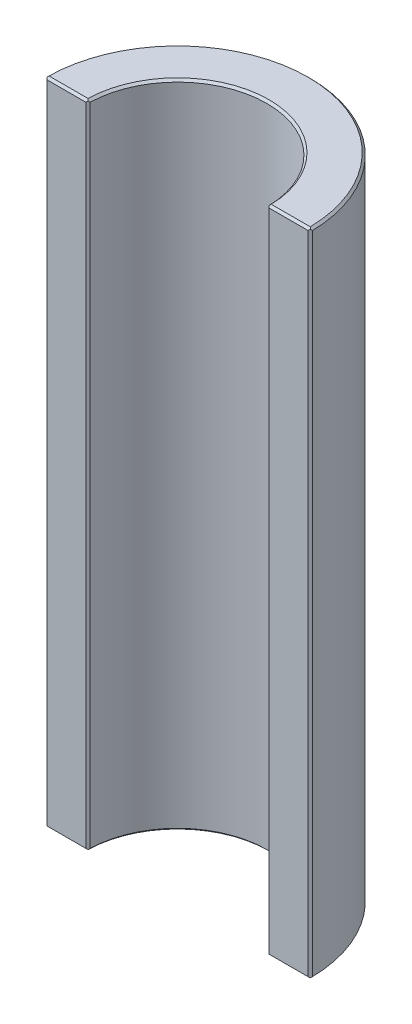
from build123d import *

# Parameters (mm, degrees)
EXTRUDE_1_DEPTH = 120
CHAMFER_2_SIZE  = 0.4


with BuildPart() as part:
    # 草图1 → 凸台-拉伸1 (new body)
    with BuildSketch(Plane(origin=(0, 0, 0), x_dir=(1, 0, 0), z_dir=(0, 1, 0))):
        with BuildLine():
            Line((-24.5, 0), (-16.5, 0))
            ThreePointArc((-16.5, 0), (0, 16.5), (16.5, 0))
            Line((16.5, 0), (24.5, 0))
            ThreePointArc((24.5, 0), (0, 24.5), (-24.5, 0))
        make_face()
    extrude(amount=EXTRUDE_1_DEPTH)

    # 倒角1
    # the kernel refuses this chamfer: 0.4 mm, written as the material it takes off along each edge
    with BuildSketch(Plane(origin=(15.471326805, 120, 0), x_dir=(0, -0.9996219169112966, 0.027495876610585543), z_dir=(1, 0, 0)), Plane(origin=(-25.528673195, 120, 0), x_dir=(0, -0.9996219169112966, 0.027495876610585543), z_dir=(1, 0, 0))) as chamfer_1_piece_1:
        with BuildLine():
            Line((0.411469278, 0), (-0.022618862, 0.410847117))
            Line((-0.022618862, 0.410847117), (-0.030615837, 0.41062715))
            ThreePointArc((-0.030615837, 0.41062715), (-0.013651691, 0.205359132), (-0.007996975, -0.000219967))
            Line((-0.007996975, -0.000219967), (0.000219967, -0.007996975))
            ThreePointArc((0.000219967, -0.007996975), (0.205799066, -0.00234226), (0.411689245, -0.007996975))
            Line((0.411689245, -0.007996975), (0.411469278, 0))
        make_face()
    extrude(amount=10.05734639, mode=Mode.SUBTRACT)
    with BuildSketch(Plane(origin=(15.471326805, 0, 0), x_dir=(0, 0.9996219169112968, 0.02749587661058639), z_dir=(1, 0, 0)), Plane(origin=(-25.528673195, 0, 0), x_dir=(0, 0.9996219169112968, 0.02749587661058639), z_dir=(1, 0, 0))) as chamfer_1_piece_2:
        with BuildLine():
            Line((0.411469278, 0), (-0.022618862, -0.410847117))
            Line((-0.022618862, -0.410847117), (-0.030615837, -0.41062715))
            ThreePointArc((-0.030615837, -0.41062715), (-0.013651691, -0.205359132), (-0.007996975, 0.000219967))
            Line((-0.007996975, 0.000219967), (0.000219967, 0.007996975))
            ThreePointArc((0.000219967, 0.007996975), (0.205799066, 0.00234226), (0.411689245, 0.007996975))
            Line((0.411689245, 0.007996975), (0.411469278, 0))
        make_face()
    extrude(amount=10.05734639, mode=Mode.SUBTRACT)
    with BuildSketch(Plane(origin=(24.5, -1.045299528, 0), x_dir=(-0.9996215998180249, 0, 0.0275074022265361), z_dir=(0, 1, 0))) as chamfer_1_piece_3:
        with BuildLine():
            Line((0.414696078, 0), (-0.019340993, -0.417672243))
            Line((-0.019340993, -0.417672243), (-0.027340517, -0.417584944))
            ThreePointArc((-0.027340517, -0.417584944), (-0.012856137, -0.208775648), (-0.007996973, 0.000220059))
            Line((-0.007996973, 0.000220059), (0.000220059, 0.007996973))
            ThreePointArc((0.000220059, 0.007996973), (0.207411207, 0.002295525), (0.414916137, 0.007996973))
            Line((0.414916137, 0.007996973), (0.414696078, 0))
        make_face()
    extrude(amount=122.090599055, mode=Mode.SUBTRACT)
    with BuildSketch(Plane(origin=(16.5, -1.017165076, 0), x_dir=(-0.039969745571149635, 0, -0.9992008904314376), z_dir=(0, 1, 0))) as chamfer_1_piece_4:
        with BuildLine():
            Line((0.402032829, 0), (-0.027426276, -0.405940594))
            Line((-0.027426276, -0.405940594), (-0.035419883, -0.405620836))
            ThreePointArc((-0.035419883, -0.405620836), (-0.016121703, -0.20287395), (-0.007993607, 0.000319758))
            Line((-0.007993607, 0.000319758), (0.000319758, 0.007993607))
            ThreePointArc((0.000319758, 0.007993607), (0.201049453, 0.001188032), (0.4021633, 0.007998936))
            Line((0.4021633, 0.007998936), (0.402032829, 0))
        make_face()
    extrude(amount=122.034330152, mode=Mode.SUBTRACT)
    with BuildSketch(Plane(origin=(-16.5, -1.017165076, 0), x_dir=(-0.9996224657663016, 0, 0.02747591554978717), z_dir=(0, 1, 0))) as chamfer_1_piece_5:
        with BuildLine():
            Line((0.40686603, 0), (-0.027100476, -0.401118387))
            Line((-0.027100476, -0.401118387), (-0.035090013, -0.400709363))
            ThreePointArc((-0.035090013, -0.400709363), (-0.014737795, -0.200512073), (-0.00799698, 0.000219807))
            Line((-0.00799698, 0.000219807), (0.000219807, 0.00799698))
            ThreePointArc((0.000219807, 0.00799698), (0.203499246, 0.002409582), (0.407085838, 0.00799698))
            Line((0.407085838, 0.00799698), (0.40686603, 0))
        make_face()
    extrude(amount=122.034330152, mode=Mode.SUBTRACT)
    with BuildSketch(Plane(origin=(-24.5, -1.045299528, 0), x_dir=(0.9996215998180249, 0, 0.02750740222653502), z_dir=(0, 1, 0))) as chamfer_1_piece_6:
        with BuildLine():
            Line((0.414696078, 0), (-0.019340993, 0.417672243))
            Line((-0.019340993, 0.417672243), (-0.027340517, 0.417584944))
            ThreePointArc((-0.027340517, 0.417584944), (-0.012856137, 0.208775648), (-0.007996973, -0.000220059))
            Line((-0.007996973, -0.000220059), (0.000220059, -0.007996973))
            ThreePointArc((0.000220059, -0.007996973), (0.207411207, -0.002295525), (0.414916137, -0.007996973))
            Line((0.414916137, -0.007996973), (0.414696078, 0))
        make_face()
    extrude(amount=122.090599055, mode=Mode.SUBTRACT)

    # 倒角2
    chamfer_2_edges = [part.edges().sort_by_distance(p)[0] for p in [
        (0, 0, -24.5),
        (0, 0, -16.5),
        (0, 120, -16.5),
        (0, 120, -24.5),
    ]]
    chamfer(chamfer_2_edges, length=CHAMFER_2_SIZE)


solid = part.part
